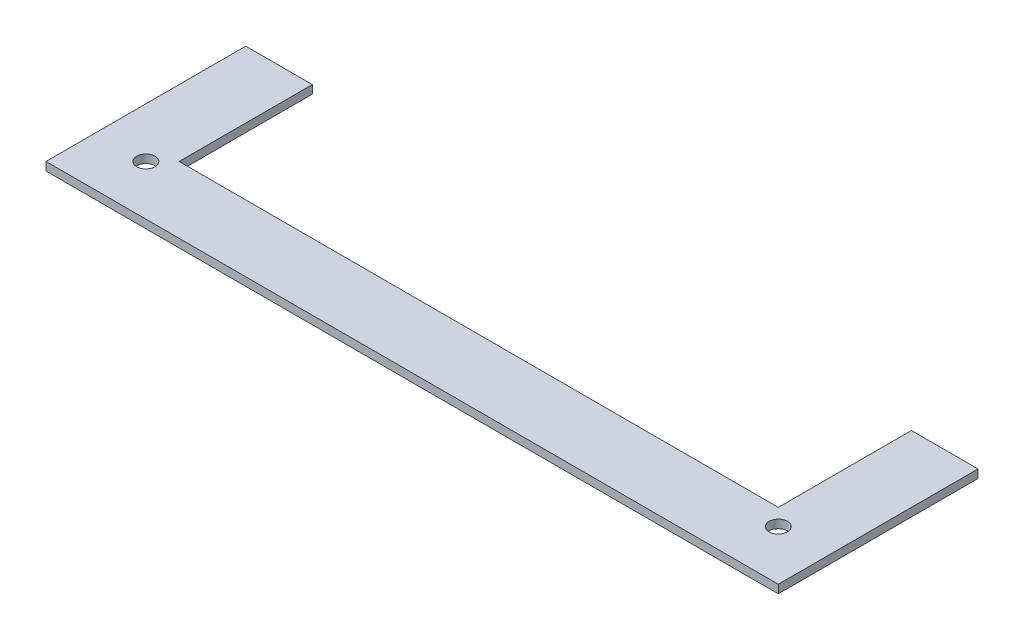
from build123d import *

# Parameters (mm, degrees)
SKETCH1_R           = 3.5
BOSS_EXTRUDE1_DEPTH = 3.175


with BuildPart() as part:
    # Sketch1 → Boss-Extrude1 (new body)
    with BuildSketch(Plane(origin=(0, 0, 0), x_dir=(1, 0, 0), z_dir=(0, 1, 0))):
        Polygon((-139.7, 63.5), (-114.3, 63.5), (-114.3, 12.7), (114.3, 12.7), (114.3, 63.5), (139.7, 63.5), (139.7, -12.7), (-139.7, -12.7), align=None)
        with Locations((-120.65, 6.35)):
            Circle(SKETCH1_R, mode=Mode.SUBTRACT)
        with Locations((120.65, 6.35)):
            Circle(SKETCH1_R, mode=Mode.SUBTRACT)
    extrude(amount=BOSS_EXTRUDE1_DEPTH)


solid = part.part
